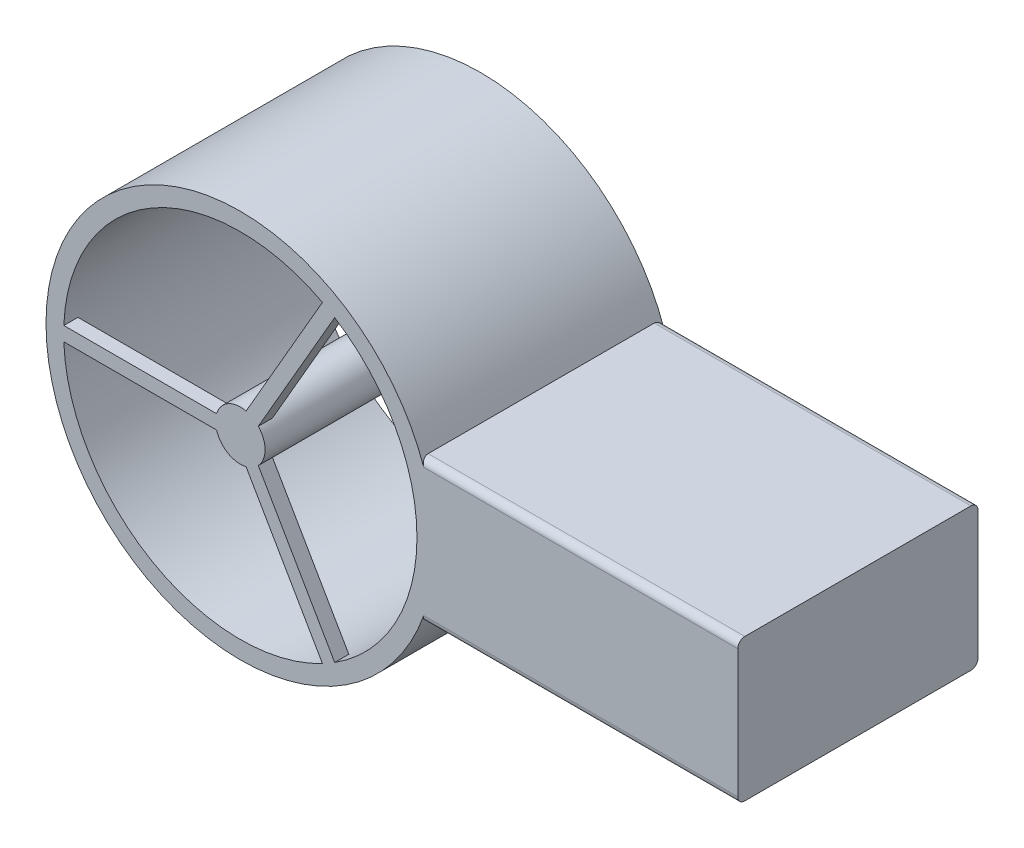
from build123d import *

# Parameters (mm, degrees)
SKETCH1_R           = 34.925
BOSS_EXTRUDE1_DEPTH = 21.59
SKETCH2_W           = 43.18
SKETCH2_H           = 25.6
BOSS_EXTRUDE2_DEPTH = 89.408
SKETCH3_R           = 31.75
CUT_EXTRUDE1_DEPTH  = 106.252356216
SKETCH4_R           = 4.450657561
BOSS_EXTRUDE3_DEPTH = 43.18
EXTRUDE_THIN1_START = -2.54
EXTRUDE_THIN1_DEPTH = 2.54
FILLET1_R           = 1.27


# Read off the part's stored shape, not the designer's step: Extrude-Thin1
with BuildPart() as part:
    # Sketch1 → Boss-Extrude1 (new, symmetric)
    with BuildSketch(Plane.XY):
        Circle(SKETCH1_R)
    extrude(amount=BOSS_EXTRUDE1_DEPTH, both=True)

    # Sketch2 → Boss-Extrude2 (add)
    with BuildSketch(Plane(origin=(0, 0, 0), x_dir=(0, 0, -1), z_dir=(1, 0, 0))):
        Rectangle(SKETCH2_W, SKETCH2_H)
    extrude(amount=BOSS_EXTRUDE2_DEPTH)

    # Sketch3 → Cut-Extrude1 (cut, through all)
    with BuildSketch(Plane.XY.offset(21.59)):
        Circle(SKETCH3_R)
    extrude(amount=-CUT_EXTRUDE1_DEPTH, mode=Mode.SUBTRACT)



with BuildPart() as body_2:
    # Sketch4 → Boss-Extrude3 (new body)
    with BuildSketch(Plane.XY.offset(21.59)):
        Circle(SKETCH4_R)
    extrude(amount=-BOSS_EXTRUDE3_DEPTH)


with BuildPart() as part_1:
    add(part.part)

    add(body_2.part)  # Extrude-Thin1 merges body 2
    # Extrude-Thin1 outline → Extrude-Thin1 (add)
    with BuildSketch(Plane.XY.offset(21.59).offset(EXTRUDE_THIN1_START)):
        with BuildLine():
            ThreePointArc((-31.724589832, 1.27), (-31.75, 0), (-31.724589832, -1.27))
            Line((-31.724589832, -1.27), (-4.265612819, -1.27))
            ThreePointArc((-4.265612819, -1.27), (-4.450657561, 0), (-4.265612819, 1.27))
            Line((-4.265612819, 1.27), (-31.724589832, 1.27))
        make_face()
        with BuildLine():
            Line((1.032954147, -4.329129064), (14.762442653, -28.109300719))
            ThreePointArc((14.762442653, -28.109300719), (15.875, -27.49630657), (16.962147179, -26.839300719))
            Line((16.962147179, -26.839300719), (3.232658672, -3.059129064))
            ThreePointArc((3.232658672, -3.059129064), (2.225328781, -3.854382511), (1.032954147, -4.329129064))
        make_face()
        with BuildLine():
            ThreePointArc((16.962147179, 26.839300719), (15.875, 27.49630657), (14.762442653, 28.109300719))
            Line((14.762442653, 28.109300719), (1.032954147, 4.329129064))
            ThreePointArc((1.032954147, 4.329129064), (2.225328781, 3.854382511), (3.232658672, 3.059129064))
            Line((3.232658672, 3.059129064), (16.962147179, 26.839300719))
        make_face()
    extrude_thin1 = extrude(amount=EXTRUDE_THIN1_DEPTH)

    # Mirror1: Extrude-Thin1 across plane
    add(extrude_thin1.mirror(Plane.XY))

    # Fillet1
    fillet1_edges = [part_1.edges().sort_by_distance(p)[0] for p in [
        (60.951427681, 12.8, -21.59),
        (60.951427681, -12.8, 21.59),
        (60.951427681, -12.8, -21.59),
        (60.951427681, 12.8, 21.59),
    ]]
    fillet(fillet1_edges, radius=FILLET1_R)


solid = part_1.part
